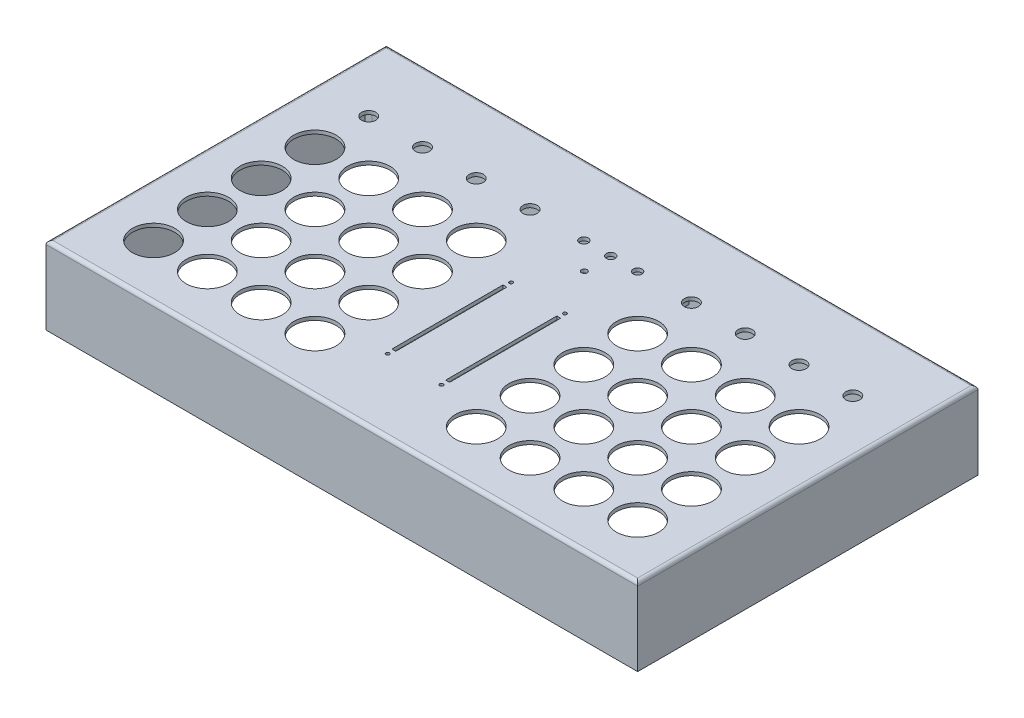
from build123d import *

# Parameters (mm, degrees)
SKETCH2_W           = 335.5
SKETCH2_H           = 193
SKETCH2_R           = 12
SKETCH2_R_2         = 1
SKETCH2_R_3         = 4
SKETCH2_W_2         = 2.2
SKETCH2_H_2         = 63
BOSS_EXTRUDE1_DEPTH = 44
SHELL1_T            = -2
FILLET1_R           = 2
SKETCH3_R           = 2.5
SKETCH3_R_2         = 1.6
CUT_EXTRUDE1_DEPTH  = 10
SKETCH4_R           = 4
BOSS_EXTRUDE2_DEPTH = 5
FILLET2_R           = 1
SKETCH5_R           = 1.75
CUT_EXTRUDE2_DEPTH  = 4
BOSS_EXTRUDE3_START = -4
BOSS_EXTRUDE3_DEPTH = 20
SKETCH7_R           = 1.75
CUT_EXTRUDE3_DEPTH  = 10


with BuildPart() as part:
    # Sketch2 → Boss-Extrude1 (new body)
    with BuildSketch(Plane(origin=(0, 0, 0), x_dir=(1, 0, 0), z_dir=(0, 1, 0))):
        with Locations((137.25, 66)):
            Rectangle(SKETCH2_W, SKETCH2_H)
        Circle(SKETCH2_R, mode=Mode.SUBTRACT)
        with Locations((30.5, 0)):
            Circle(SKETCH2_R, mode=Mode.SUBTRACT)
        with Locations((61, 0)):
            Circle(SKETCH2_R, mode=Mode.SUBTRACT)
        with Locations((91.5, 0)):
            Circle(SKETCH2_R, mode=Mode.SUBTRACT)
        with Locations((30.5, 30.5)):
            Circle(SKETCH2_R, mode=Mode.SUBTRACT)
        with Locations((61, 30.5)):
            Circle(SKETCH2_R, mode=Mode.SUBTRACT)
        with Locations((91.5, 30.5)):
            Circle(SKETCH2_R, mode=Mode.SUBTRACT)
        with Locations((30.5, 61)):
            Circle(SKETCH2_R, mode=Mode.SUBTRACT)
        with Locations((61, 61)):
            Circle(SKETCH2_R, mode=Mode.SUBTRACT)
        with Locations((91.5, 61)):
            Circle(SKETCH2_R, mode=Mode.SUBTRACT)
        with Locations((30.5, 91.5)):
            Circle(SKETCH2_R, mode=Mode.SUBTRACT)
        with Locations((61, 91.5)):
            Circle(SKETCH2_R, mode=Mode.SUBTRACT)
        with Locations((91.5, 91.5)):
            Circle(SKETCH2_R, mode=Mode.SUBTRACT)
        with Locations((0, 30.5)):
            Circle(SKETCH2_R, mode=Mode.SUBTRACT)
        with Locations((0, 61)):
            Circle(SKETCH2_R, mode=Mode.SUBTRACT)
        with Locations((0, 91.5)):
            Circle(SKETCH2_R, mode=Mode.SUBTRACT)
        with Locations((122, 80.75)):
            Circle(SKETCH2_R_2, mode=Mode.SUBTRACT)
        with Locations((122, 10.75)):
            Circle(SKETCH2_R_2, mode=Mode.SUBTRACT)
        with Locations((0, 122)):
            Circle(SKETCH2_R_3, mode=Mode.SUBTRACT)
        with Locations((30.5, 122)):
            Circle(SKETCH2_R_3, mode=Mode.SUBTRACT)
        with Locations((61, 122)):
            Circle(SKETCH2_R_3, mode=Mode.SUBTRACT)
        with Locations((91.5, 122)):
            Circle(SKETCH2_R_3, mode=Mode.SUBTRACT)
        with Locations((183, 122)):
            Circle(SKETCH2_R_3, mode=Mode.SUBTRACT)
        with Locations((213.5, 122)):
            Circle(SKETCH2_R_3, mode=Mode.SUBTRACT)
        with Locations((244, 122)):
            Circle(SKETCH2_R_3, mode=Mode.SUBTRACT)
        with Locations((274.5, 122)):
            Circle(SKETCH2_R_3, mode=Mode.SUBTRACT)
        with Locations((152.5, 10.75)):
            Circle(SKETCH2_R_2, mode=Mode.SUBTRACT)
        with Locations((152.5, 80.75)):
            Circle(SKETCH2_R_2, mode=Mode.SUBTRACT)
        with Locations((274.5, 91.5)):
            Circle(SKETCH2_R, mode=Mode.SUBTRACT)
        with Locations((274.5, 61)):
            Circle(SKETCH2_R, mode=Mode.SUBTRACT)
        with Locations((274.5, 30.5)):
            Circle(SKETCH2_R, mode=Mode.SUBTRACT)
        with Locations((183, 91.5)):
            Circle(SKETCH2_R, mode=Mode.SUBTRACT)
        with Locations((213.5, 91.5)):
            Circle(SKETCH2_R, mode=Mode.SUBTRACT)
        with Locations((244, 91.5)):
            Circle(SKETCH2_R, mode=Mode.SUBTRACT)
        with Locations((183, 61)):
            Circle(SKETCH2_R, mode=Mode.SUBTRACT)
        with Locations((213.5, 61)):
            Circle(SKETCH2_R, mode=Mode.SUBTRACT)
        with Locations((244, 61)):
            Circle(SKETCH2_R, mode=Mode.SUBTRACT)
        with Locations((183, 30.5)):
            Circle(SKETCH2_R, mode=Mode.SUBTRACT)
        with Locations((213.5, 30.5)):
            Circle(SKETCH2_R, mode=Mode.SUBTRACT)
        with Locations((244, 30.5)):
            Circle(SKETCH2_R, mode=Mode.SUBTRACT)
        with Locations((183, 0)):
            Circle(SKETCH2_R, mode=Mode.SUBTRACT)
        with Locations((213.5, 0)):
            Circle(SKETCH2_R, mode=Mode.SUBTRACT)
        with Locations((244, 0)):
            Circle(SKETCH2_R, mode=Mode.SUBTRACT)
        with Locations((274.5, 0)):
            Circle(SKETCH2_R, mode=Mode.SUBTRACT)
        with Locations((122, 45.75)):
            Rectangle(SKETCH2_W_2, SKETCH2_H_2, mode=Mode.SUBTRACT)
        with Locations((152.5, 45.75)):
            Rectangle(SKETCH2_W_2, SKETCH2_H_2, mode=Mode.SUBTRACT)
    extrude(amount=BOSS_EXTRUDE1_DEPTH)

    # Shell1
    shell1_openings = [part.faces().sort_by_distance(p)[0] for p in [
        (137.25, 0, -71.576433163),
        (-12, 22, 0),
        (18.5, 22, 0),
        (49, 22, 0),
        (79.5, 22, 0),
        (79.5, 22, -30.5),
        (49, 22, -30.5),
        (18.5, 22, -30.5),
        (-12, 22, -30.5),
        (-12, 22, -61),
        (-12, 22, -91.5),
        (18.5, 22, -91.5),
        (18.5, 22, -61),
        (49, 22, -61),
        (49, 22, -91.5),
        (79.5, 22, -91.5),
        (79.5, 22, -61),
        (-4, 22, -122),
        (26.5, 22, -122),
        (87.5, 22, -122),
        (57, 22, -122),
        (121, 22, -80.75),
        (151.5, 22, -80.75),
        (179, 22, -122),
        (171, 22, -91.5),
        (201.5, 22, -91.5),
        (209.5, 22, -122),
        (171, 22, -61),
        (171, 22, -30.5),
        (171, 22, 0),
        (201.5, 22, 0),
        (201.5, 22, -30.5),
        (201.5, 22, -61),
        (232, 22, -61),
        (232, 22, -30.5),
        (232, 22, 0),
        (262.5, 22, 0),
        (262.5, 22, -30.5),
        (262.5, 22, -61),
        (262.5, 22, -91.5),
        (232, 22, -91.5),
        (240, 22, -122),
        (270.5, 22, -122),
        (151.5, 22, -10.75),
        (121, 22, -10.75),
        (153.6, 22, -45.75),
        (152.5, 22, -77.25),
        (122, 22, -77.25),
        (123.1, 22, -45.75),
        (120.9, 22, -45.75),
        (122, 22, -14.25),
        (151.4, 22, -45.75),
        (152.5, 22, -14.25),
    ]]
    offset(amount=SHELL1_T, openings=shell1_openings, kind=Kind.INTERSECTION)

    # Fillet1
    fillet1_edges = [part.edges().sort_by_distance(p)[0] for p in [
        (-30.5, 44, -66),
        (137.25, 44, 30.5),
        (305, 44, -66),
        (137.25, 44, -162.5),
    ]]
    fillet(fillet1_edges, radius=FILLET1_R)

    # Sketch3 → Cut-Extrude1 (cut)
    with BuildSketch(Plane(origin=(0, 44, 0), x_dir=(1, 0, 0), z_dir=(0, 1, 0))):
        with Locations((122, 122)):
            Circle(SKETCH3_R)
        with Locations((137.25, 122)):
            Circle(SKETCH3_R)
        with Locations((152.5, 122)):
            Circle(SKETCH3_R)
        with Locations((137.25, 107)):
            Circle(SKETCH3_R_2)
    extrude(amount=-CUT_EXTRUDE1_DEPTH, mode=Mode.SUBTRACT)

    # Sketch4 → Boss-Extrude2 (add)
    with BuildSketch(Plane.XZ.offset(-42)):
        with Locations((157.25, -107)):
            Circle(SKETCH4_R)
        with Locations((117.25, -107)):
            Circle(SKETCH4_R)
    extrude(amount=BOSS_EXTRUDE2_DEPTH)

    # Fillet2
    fillet2_edges = [part.edges().sort_by_distance(p)[0] for p in [
        (153.25, 42, -107),
        (113.25, 42, -107),
    ]]
    fillet(fillet2_edges, radius=FILLET2_R)

    # Sketch5 → Cut-Extrude2 (cut)
    with BuildSketch(Plane.XZ.offset(-37)):
        with Locations((117.25, -107)):
            Circle(SKETCH5_R)
        with Locations((157.25, -107)):
            Circle(SKETCH5_R)
    extrude(amount=-CUT_EXTRUDE2_DEPTH, mode=Mode.SUBTRACT)

    # Sketch6 → Boss-Extrude3 (add)
    with BuildSketch(Plane.XZ.offset(BOSS_EXTRUDE3_START)):
        with BuildLine():
            Line((-24.5, 16.5), (-28.5, 16.5))
            Line((-28.5, 16.5), (-28.5, 28.5))
            Line((-28.5, 28.5), (-16.5, 28.5))
            Line((-16.5, 28.5), (-16.5, 24.5))
            ThreePointArc((-16.5, 24.5), (-18.843145751, 18.843145751), (-24.5, 16.5))
        make_face()
        with BuildLine():
            Line((-24.5, -148.5), (-28.5, -148.5))
            Line((-28.5, -148.5), (-28.5, -160.5))
            Line((-28.5, -160.5), (-16.5, -160.5))
            Line((-16.5, -160.5), (-16.5, -156.5))
            ThreePointArc((-16.5, -156.5), (-18.843145751, -150.843145751), (-24.5, -148.5))
        make_face()
        with BuildLine():
            Line((299, -148.5), (303, -148.5))
            Line((303, -148.5), (303, -160.5))
            Line((303, -160.5), (291, -160.5))
            Line((291, -160.5), (291, -156.5))
            ThreePointArc((291, -156.5), (293.343145751, -150.843145751), (299, -148.5))
        make_face()
        with BuildLine():
            Line((299, 16.5), (303, 16.5))
            Line((303, 16.5), (303, 28.5))
            Line((303, 28.5), (291, 28.5))
            Line((291, 28.5), (291, 24.5))
            ThreePointArc((291, 24.5), (293.343145751, 18.843145751), (299, 16.5))
        make_face()
        with BuildLine():
            Line((137.15, 16.5), (137.35, 16.5))
            ThreePointArc((137.35, 16.5), (141.521930009, 18.228069991), (143.25, 22.4))
            Line((143.25, 22.4), (143.25, 28.5))
            Line((143.25, 28.5), (131.25, 28.5))
            Line((131.25, 28.5), (131.25, 22.4))
            ThreePointArc((131.25, 22.4), (132.978069991, 18.228069991), (137.15, 16.5))
        make_face()
        with BuildLine():
            Line((137.15, -148.5), (137.35, -148.5))
            ThreePointArc((137.35, -148.5), (141.521930009, -150.228069991), (143.25, -154.4))
            Line((143.25, -154.4), (143.25, -160.5))
            Line((143.25, -160.5), (131.25, -160.5))
            Line((131.25, -160.5), (131.25, -154.4))
            ThreePointArc((131.25, -154.4), (132.978069991, -150.228069991), (137.15, -148.5))
        make_face()
    extrude(amount=-BOSS_EXTRUDE3_DEPTH)

    # Sketch7 → Cut-Extrude3 (cut)
    with BuildSketch(Plane.XZ):
        with Locations((-22.5, 22.5)):
            Circle(SKETCH7_R)
        with Locations((137.25, 22.5)):
            Circle(SKETCH7_R)
        with Locations((297, 22.5)):
            Circle(SKETCH7_R)
        with Locations((297, -154.5)):
            Circle(SKETCH7_R)
        with Locations((137.25, -154.5)):
            Circle(SKETCH7_R)
        with Locations((-22.5, -154.5)):
            Circle(SKETCH7_R)
    extrude(amount=-CUT_EXTRUDE3_DEPTH, mode=Mode.SUBTRACT)


solid = part.part
